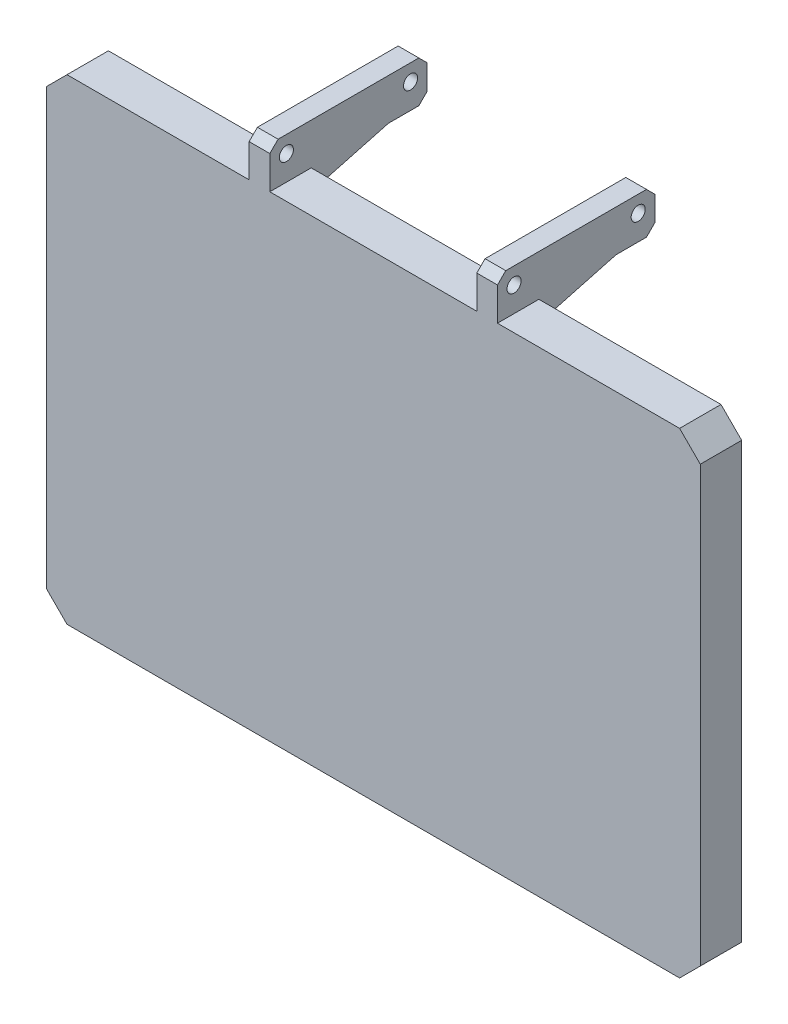
from build123d import *
from OCP.BRepFilletAPI import BRepFilletAPI_MakeChamfer

# Parameters (mm, degrees)
SKETCH1_W            = 158
SKETCH1_H            = 115
BOSS_EXTRUDE1_DEPTH  = 10
SKETCH2_W            = 148
SKETCH2_H            = 105
CUT_EXTRUDE1_DEPTH   = 2
BOSS_EXTRUDE2_DEPTH  = 1.5
SKETCH4_W            = 5
SKETCH4_H            = 10
BOSS_EXTRUDE3_DEPTH  = 38
M3_CLEARANCE_HOLE1_D = 3.4
CHAMFER3_SIZE        = 2
CHAMFER4_SIZE        = 5
CHAMFER4_SIZE_2      = 18.660254038
CHAMFER5_SIZE        = 5
CHAMFER6_SIZE        = 2


with BuildPart() as part:
    # Sketch1 → Boss-Extrude1 (new body)
    with BuildSketch(Plane.XY):
        Rectangle(SKETCH1_W, SKETCH1_H)
    extrude(amount=BOSS_EXTRUDE1_DEPTH)

    # Sketch2 → Cut-Extrude1 (cut)
    with BuildSketch(Plane(origin=(0, 0, 0), x_dir=(-1, 0, 0), z_dir=(0, 0, -1))):
        Rectangle(SKETCH2_W, SKETCH2_H)
    extrude(amount=-CUT_EXTRUDE1_DEPTH, mode=Mode.SUBTRACT)

    # Sketch3 → Boss-Extrude2 (add)
    with BuildSketch(Plane(origin=(0, 0, 0), x_dir=(-1, 0, 0), z_dir=(0, 0, -1))):
        Polygon((-74, 42.5), (-64, 52.5), (-74, 52.5), align=None)
        Polygon((74, 52.5), (74, 42.5), (64, 52.5), align=None)
        Polygon((-74, -52.5), (-74, -42.5), (-64, -52.5), align=None)
        Polygon((74, -42.5), (64, -52.5), (74, -52.5), align=None)
    extrude(amount=-BOSS_EXTRUDE2_DEPTH)

    # Sketch4 → Boss-Extrude3 (add)
    with BuildSketch(Plane.XY.offset(10)):
        with Locations((27.5, 62.5)):
            Rectangle(SKETCH4_W, SKETCH4_H)
        with Locations((-27.5, 62.5)):
            Rectangle(SKETCH4_W, SKETCH4_H)
    extrude(amount=-BOSS_EXTRUDE3_DEPTH)

    # M3 Clearance Hole1 (through all)
    with Locations(Plane(origin=(30, 0, 0), x_dir=(0, 0, -1), z_dir=(1, 0, 0))):
        with Locations((24, 63.5), (-6, 63.5)):
            Hole(M3_CLEARANCE_HOLE1_D / 2)

    # Chamfer3
    chamfer3_edges = [part.edges().sort_by_distance(p)[0] for p in [
        (-27.5, 67.5, -28),
        (27.5, 67.5, -28),
        (27.5, 67.5, 10),
        (-27.5, 67.5, 10),
    ]]
    chamfer(chamfer3_edges, length=CHAMFER3_SIZE)

    # Chamfer4
    chamfer4_edges_1 = [part.edges().sort_by_distance(p)[0] for p in [
        (-27.5, 57.5, 0),
    ]]
    chamfer4_side_1 = [part.faces().sort_by_distance(p)[0] for p in [
        (-27.5, 57.4, 0),
    ]]
    chamfer4_edges_2 = [part.edges().sort_by_distance(p)[0] for p in [
        (27.5, 57.5, 0),
    ]]
    chamfer4_side_2 = [part.faces().sort_by_distance(p)[0] for p in [
        (27.5, 57.5, -0.1),
    ]]
    chamfer4 = BRepFilletAPI_MakeChamfer(part.part.solid().wrapped)
    for e in chamfer4_edges_1:
        chamfer4.Add(CHAMFER4_SIZE - 0.0001, CHAMFER4_SIZE_2 - 0.0001, e.wrapped, chamfer4_side_1[0].wrapped)
    for e in chamfer4_edges_2:
        chamfer4.Add(CHAMFER4_SIZE_2 - 0.0001, CHAMFER4_SIZE - 0.0001, e.wrapped, chamfer4_side_2[0].wrapped)
    add(Compound.cast(chamfer4.Shape()), mode=Mode.REPLACE)  # a hair under: the kernel refuses the full size

    # Chamfer5
    chamfer5_edges = [part.edges().sort_by_distance(p)[0] for p in [
        (79, 57.5, 5),
        (-79, 57.5, 5),
        (-79, -57.5, 5),
        (79, -57.5, 5),
    ]]
    chamfer(chamfer5_edges, length=CHAMFER5_SIZE)

    # Chamfer6
    chamfer6_edges = [part.edges().sort_by_distance(p)[0] for p in [
        (-27.5, 57.5, -28),
        (27.5, 57.5, -28),
    ]]
    chamfer(chamfer6_edges, length=CHAMFER6_SIZE)


solid = part.part
